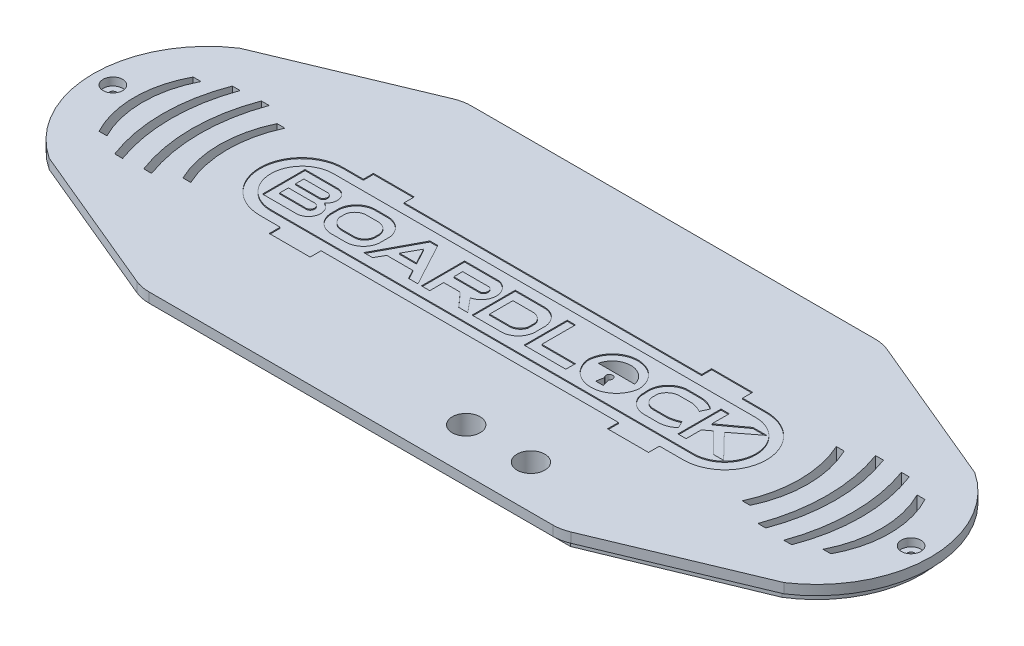
from build123d import *

# Parameters (mm, degrees)
BOSS_EXTRUDE3_DEPTH = 2.5
SKETCH2_8_R         = 3.55
BOSS_EXTRUDE4_DEPTH = 2.5
LOGO_DEPTH          = 0.25
FILLET1_R           = 10
SOUNDGAPS_REACH     = 178.856
BUTTONS_REACH       = 178.856
SKETCH5_R           = 3.55
CUT_EXTRUDE5_REACH  = 178.856
SKETCH9_R           = 2.5
CUT_EXTRUDE6_DEPTH  = 2
CUT_EXTRUDE7_REACH  = 178.856
SKETCH9_4_R         = 0.9


with BuildPart() as part:
    # Sketch2 → Boss-Extrude3 (new body)
    with BuildSketch(Plane(origin=(0, 0, 0), x_dir=(1, 0, 0), z_dir=(0, 1, 0))):
        with BuildLine():
            Line((-2.5, 2.5), (104.5, 2.5))
            Line((104.5, 2.5), (144.737244829, -14.291091061))
            ThreePointArc((144.737244829, -14.291091061), (157.8, -38.6), (144.737244829, -62.908908939))
            Line((144.737244829, -62.908908939), (104.5, -79.7))
            Line((104.5, -79.7), (-2.5, -79.7))
            Line((-2.5, -79.7), (-42.737244829, -62.908908939))
            ThreePointArc((-42.737244829, -62.908908939), (-55.8, -38.6), (-42.737244829, -14.291091061))
            Line((-42.737244829, -14.291091061), (-2.5, 2.5))
        make_face()
    extrude(amount=BOSS_EXTRUDE3_DEPTH)

    # Sketch2<8> → Boss-Extrude4 (add)
    with BuildSketch(Plane(origin=(0, 0, 0), x_dir=(1, 0, 0), z_dir=(0, 1, 0))):
        with BuildLine():
            Line((102, 0), (0, 0))
            Line((0, 0), (-2.5, 0))
            Line((-2.5, 0), (-40.702591635, -15.743739118))
            ThreePointArc((-40.702591635, -15.743739118), (-53.480653983, -38.6), (-40.702591635, -61.456260882))
            Line((-40.702591635, -61.456260882), (-2.5, -77.2))
            Line((-2.5, -77.2), (0, -77.2))
            Line((0, -77.2), (102, -77.2))
            Line((102, -77.2), (104.5, -77.2))
            Line((104.5, -77.2), (142.702591635, -61.456260882))
            ThreePointArc((142.702591635, -61.456260882), (155.480653983, -38.6), (142.702591635, -15.743739118))
            Line((142.702591635, -15.743739118), (104.5, 0))
            Line((104.5, 0), (102, 0))
        make_face()
        with Locations((69.32, -68.6)):
            Circle(SKETCH2_8_R, mode=Mode.SUBTRACT)
        with Locations((85.83, -68.6)):
            Circle(SKETCH2_8_R, mode=Mode.SUBTRACT)
    extrude(amount=-BOSS_EXTRUDE4_DEPTH)

    # Sketch3 → Logo (cut)
    # profile 1 of 10: a face of its own
    with BuildSketch(Plane(origin=(0, 2.5, 0), x_dir=(1, 0, 0), z_dir=(0, 1, 0))):
        with BuildLine():
            Line((1.949493887, -27.461955416), (-2.987330566, -27.461955416))
            ThreePointArc((-2.987330566, -27.461955416), (-13.803120325, -38.068295938), (-2.987330566, -48.674636459))
            Line((-2.987330566, -48.674636459), (1.949493887, -48.674636459))
            Line((1.949493887, -48.674636459), (1.949493887, -51.464582861))
            Line((1.949493887, -51.464582861), (12.371678844, -51.464582861))
            Line((12.371678844, -51.464582861), (12.371678844, -48.674636459))
            Line((12.371678844, -48.674636459), (88.239814758, -48.674636459))
            Line((88.239814758, -48.674636459), (88.239814758, -51.464582861))
            Line((88.239814758, -51.464582861), (98.688646078, -51.464582861))
            Line((98.688646078, -51.464582861), (98.688646078, -48.674636459))
            Line((98.688646078, -48.674636459), (104.624475689, -48.674636459))
            ThreePointArc((104.624475689, -48.674636459), (115.383426883, -38.068295938), (104.624475689, -27.461955416))
            Line((104.624475689, -27.461955416), (98.688646078, -27.461955416))
            Line((98.688646078, -27.461955416), (98.688646078, -24.902120515))
            Line((98.688646078, -24.902120515), (88.239814758, -24.902120515))
            Line((88.239814758, -24.902120515), (88.239814758, -27.461955416))
            Line((88.239814758, -27.461955416), (12.371678844, -27.461955416))
            Line((12.371678844, -27.461955416), (12.371678844, -24.902120515))
            Line((12.371678844, -24.902120515), (1.949493887, -24.902120515))
            Line((1.949493887, -24.902120515), (1.949493887, -27.461955416))
        make_face()
        with BuildLine():
            ThreePointArc((-3.194751797, -46.01575407), (-11.064312283, -37.938772353), (-2.987330566, -30.069211866))
            Line((-2.987330566, -30.069211866), (104.700239847, -30.069211866))
            ThreePointArc((104.700239847, -30.069211866), (112.673510949, -38.042482968), (104.700239847, -46.01575407))
            Line((104.700239847, -46.01575407), (-3.194751797, -46.01575407))
        make_face(mode=Mode.SUBTRACT)
    # profile 2 of 10: a face of its own
    with BuildSketch(Plane(origin=(0, 2.5, 0), x_dir=(1, 0, 0), z_dir=(0, 1, 0))):
        with BuildLine():
            Line((0.713326147, -32.762452382), (-7.630609586, -32.762452382))
            Line((-7.630609586, -32.762452382), (-7.630609586, -43.623173078))
            Line((-7.630609586, -43.623173078), (1.144127176, -43.623173078))
            ThreePointArc((1.144127176, -43.623173078), (4.072531045, -41.089719603), (2.23246662, -37.682653616))
            ThreePointArc((2.23246662, -37.682653616), (3.210405226, -34.686087135), (0.713326147, -32.762452382))
        make_face()
        with BuildLine():
            Line((-5.680668083, -41.17440933), (-5.680668083, -38.952382967))
            Line((-5.680668083, -38.952382967), (0.713326147, -38.952382967))
            ThreePointArc((0.713326147, -38.952382967), (2.127219592, -40.063396149), (0.713326147, -41.17440933))
            Line((0.713326147, -41.17440933), (-5.680668083, -41.17440933))
        make_face(mode=Mode.SUBTRACT)
        with BuildLine():
            Line((-5.680668083, -37.138483894), (-5.680668083, -35.007152484))
            Line((-5.680668083, -35.007152484), (0.600049584, -35.007152484))
            ThreePointArc((0.600049584, -35.007152484), (1.408506175, -36.072818189), (0.600049584, -37.138483894))
            Line((0.600049584, -37.138483894), (-5.680668083, -37.138483894))
        make_face(mode=Mode.SUBTRACT)
    # profile 3 of 10: a face of its own
    with BuildSketch(Plane(origin=(0, 2.5, 0), x_dir=(1, 0, 0), z_dir=(0, 1, 0))):
        with BuildLine():
            Line((5.346460441, -36.917426319), (5.346460441, -39.213930644))
            ThreePointArc((5.346460441, -39.213930644), (6.885943052, -42.434479638), (10.251793679, -43.623173078))
            Line((10.251793679, -43.623173078), (13.828264636, -43.623173078))
            ThreePointArc((13.828264636, -43.623173078), (16.716995574, -42.386317426), (18.096652452, -39.562999301))
            Line((18.096652452, -39.562999301), (18.096652452, -36.788822077))
            ThreePointArc((18.096652452, -36.788822077), (16.446939465, -33.787674903), (13.228063284, -32.618370223))
            Line((13.228063284, -32.618370223), (9.865980952, -32.618370223))
            ThreePointArc((9.865980952, -32.618370223), (6.816585637, -33.937769105), (5.346460441, -36.917426319))
        make_face()
        with BuildLine():
            ThreePointArc((7.340408181, -37.428569745), (8.31320862, -35.726361526), (10.137103318, -35.007152484))
            Line((10.137103318, -35.007152484), (13.346680486, -35.007152484))
            ThreePointArc((13.346680486, -35.007152484), (15.178018472, -35.715584435), (16.137891368, -37.428569745))
            Line((16.137891368, -37.428569745), (16.137891368, -38.787399969))
            ThreePointArc((16.137891368, -38.787399969), (15.339335986, -40.518029243), (13.608745934, -41.316669621))
            Line((13.608745934, -41.316669621), (10.291673968, -41.316669621))
            ThreePointArc((10.291673968, -41.316669621), (8.405132361, -40.657148151), (7.340408181, -38.965885242))
            Line((7.340408181, -38.965885242), (7.340408181, -37.428569745))
        make_face(mode=Mode.SUBTRACT)
    # profile 4 of 10: a face of its own
    with BuildSketch(Plane(origin=(0, 2.5, 0), x_dir=(1, 0, 0), z_dir=(0, 1, 0))):
        Polygon((24.087565187, -32.618370223), (18.222944768, -43.623173078), (20.462903956, -43.623173078), (21.766152938, -41.316669621), (28.404577439, -41.316669621), (29.646736625, -43.623173078), (32.02923867, -43.623173078), (26.102641459, -32.618370223), align=None)
        Polygon((27.243871315, -39.213930644), (22.906495797, -39.213930644), (25.095103323, -35.2239905), align=None, mode=Mode.SUBTRACT)
    # profile 5 of 10: a face of its own
    with BuildSketch(Plane(origin=(0, 2.5, 0), x_dir=(1, 0, 0), z_dir=(0, 1, 0))):
        with BuildLine():
            Line((41.793638287, -32.618370223), (32.928013354, -32.618370223))
            Line((32.928013354, -32.618370223), (32.928013354, -43.623173078))
            Line((32.928013354, -43.623173078), (35.04301538, -43.623173078))
            Line((35.04301538, -43.623173078), (35.04301538, -40.063396149))
            Line((35.04301538, -40.063396149), (39.244046803, -40.063396149))
            Line((39.244046803, -40.063396149), (42.431036158, -43.623173078))
            Line((42.431036158, -43.623173078), (44.737782461, -43.623173078))
            Line((44.737782461, -43.623173078), (41.793638287, -40.063396149))
            ThreePointArc((41.793638287, -40.063396149), (44.733866299, -36.340883186), (41.793638287, -32.618370223))
        make_face()
        with BuildLine():
            Line((35.04301538, -37.48051524), (35.04301538, -35.2239905))
            Line((35.04301538, -35.2239905), (41.793638287, -35.2239905))
            ThreePointArc((41.793638287, -35.2239905), (42.65693054, -36.35225287), (41.793638287, -37.48051524))
            Line((41.793638287, -37.48051524), (35.04301538, -37.48051524))
        make_face(mode=Mode.SUBTRACT)
    # profile 6 of 10: a face of its own
    with BuildSketch(Plane(origin=(0, 2.5, 0), x_dir=(1, 0, 0), z_dir=(0, 1, 0))):
        with BuildLine():
            Line((52.968722487, -32.618370223), (45.846335848, -32.618370223))
            Line((45.846335848, -32.618370223), (45.846335848, -43.623173078))
            Line((45.846335848, -43.623173078), (52.83287315, -43.623173078))
            ThreePointArc((52.83287315, -43.623173078), (56.080236632, -42.589880341), (57.64582107, -39.562999301))
            Line((57.64582107, -39.562999301), (57.64582107, -36.788822077))
            ThreePointArc((57.64582107, -36.788822077), (56.171000638, -33.734937317), (52.968722487, -32.618370223))
        make_face()
        with BuildLine():
            Line((47.864668846, -41.17440933), (47.864668846, -35.2239905))
            Line((47.864668846, -35.2239905), (52.599988574, -35.2239905))
            ThreePointArc((52.599988574, -35.2239905), (54.440160348, -35.663250015), (55.624586826, -37.138483894))
            Line((55.624586826, -37.138483894), (55.624586826, -39.18661223))
            ThreePointArc((55.624586826, -39.18661223), (54.462155657, -40.712863912), (52.599988574, -41.17440933))
            Line((52.599988574, -41.17440933), (47.864668846, -41.17440933))
        make_face(mode=Mode.SUBTRACT)
    # profile 7 of 10: a face of its own
    with BuildSketch(Plane(origin=(0, 2.5, 0), x_dir=(1, 0, 0), z_dir=(0, 1, 0))):
        Polygon((61.195413218, -32.618370223), (59.109629375, -32.618370223), (59.109629375, -43.623173078), (69.752475136, -43.623173078), (69.752475136, -41.187576484), (61.195413218, -41.187576484), align=None)
    # profile 8 of 10: a face of its own
    with BuildSketch(Plane(origin=(0, 2.5, 0), x_dir=(1, 0, 0), z_dir=(0, 1, 0))):
        with BuildLine():
            ThreePointArc((86.967057925, -37.33302991), (88.24698918, -35.587564651), (90.332173753, -35.007152484))
            Line((90.332173753, -35.007152484), (93.354874286, -35.007152484))
            ThreePointArc((93.354874286, -35.007152484), (94.768458464, -35.327728442), (96.082389221, -35.939753883))
            Line((96.082389221, -35.939753883), (96.979753441, -33.956106658))
            ThreePointArc((96.979753441, -33.956106658), (95.096667996, -32.952004021), (92.988844144, -32.618370223))
            Line((92.988844144, -32.618370223), (89.529268924, -32.618370223))
            ThreePointArc((89.529268924, -32.618370223), (85.927201794, -34.605805074), (84.941711164, -38.6))
            Line((84.941711164, -38.6), (84.941711164, -39.513929713))
            ThreePointArc((84.941711164, -39.513929713), (86.739352365, -42.572399213), (90.127806859, -43.623173078))
            Line((90.127806859, -43.623173078), (93.049792527, -43.623173078))
            ThreePointArc((93.049792527, -43.623173078), (95.178031827, -43.279186153), (97.039888867, -42.192347671))
            Line((97.039888867, -42.192347671), (96.15967403, -40.380436784))
            ThreePointArc((96.15967403, -40.380436784), (94.749505142, -40.914672607), (93.266431414, -41.187576484))
            Line((93.266431414, -41.187576484), (89.766541153, -41.187576484))
            ThreePointArc((89.766541153, -41.187576484), (87.98359415, -40.626914615), (86.967057925, -39.058509102))
            Line((86.967057925, -39.058509102), (86.967057925, -37.33302991))
        make_face()
    # profile 9 of 10: a face of its own
    with BuildSketch(Plane(origin=(0, 2.5, 0), x_dir=(1, 0, 0), z_dir=(0, 1, 0))):
        Polygon((100.433477861, -32.619456407), (98.346127272, -32.619456407), (98.346127272, -43.625930338), (100.433477861, -43.625930338), (100.433477861, -39.738654566), (102.223113581, -38.43184366), (107.375394287, -43.625930338), (110.007271118, -43.625930338), (103.904039503, -37.33302991), (110.007271118, -32.619456407), (106.490539146, -32.619456407), (100.433477861, -37.042386537), align=None)
    # profile 10 of 10: a face of its own
    with BuildSketch(Plane(origin=(0, 2.5, 0), x_dir=(1, 0, 0), z_dir=(0, 1, 0))):
        with BuildLine():
            ThreePointArc((83.440446503, -38.6), (76.914090873, -32.366505687), (70.387735243, -38.6))
            ThreePointArc((70.387735243, -38.6), (76.914090873, -44.419626268), (83.440446503, -38.6))
        make_face()
        with BuildLine():
            Line((75.957169691, -42.192347671), (76.285044547, -40.252788166))
            ThreePointArc((76.285044547, -40.252788166), (76.809249819, -38.728957059), (77.33345509, -40.252788166))
            Line((77.33345509, -40.252788166), (77.846095102, -42.192347671))
            Line((77.846095102, -42.192347671), (75.957169691, -42.192347671))
        make_face(mode=Mode.SUBTRACT)
        with BuildLine():
            Line((81.605728053, -37.905608877), (72.327294748, -37.905608877))
            ThreePointArc((72.327294748, -37.905608877), (76.9665114, -34.227223026), (81.605728053, -37.905608877))
        make_face(mode=Mode.SUBTRACT)
    extrude(amount=-LOGO_DEPTH, mode=Mode.SUBTRACT)

    # Fillet1
    fillet1_edges = [part.edges().sort_by_distance(p)[0] for p in [
        (-2.5, 1.25, -2.5),
        (104.5, 1.25, -2.5),
        (104.5, 1.25, 79.7),
        (-2.5, 1.25, 79.7),
    ]]
    fillet(fillet1_edges, radius=FILLET1_R)

    # Sketch4 → SoundGaps (cut, up to next)
    with BuildSketch(Plane(origin=(0, 2.5, 0), x_dir=(1, 0, 0), z_dir=(0, 1, 0)), mode=Mode.PRIVATE) as soundgaps_sk1:
        with BuildLine():
            Line((-42.336442958, -26.6), (-40.336442958, -26.6))
            ThreePointArc((-40.336442958, -26.6), (-43.210098634, -38.6), (-40.336442958, -50.6))
            Line((-40.336442958, -50.6), (-42.336442958, -50.6))
            ThreePointArc((-42.336442958, -50.6), (-45.345121926, -38.6), (-42.336442958, -26.6))
        make_face()
    soundgaps_tool1 = extrude(soundgaps_sk1.sketch, amount=-SOUNDGAPS_REACH, mode=Mode.PRIVATE) & part.part
    # Sketch4 → SoundGaps (cut, up to next)
    with BuildSketch(Plane(origin=(0, 2.5, 0), x_dir=(1, 0, 0), z_dir=(0, 1, 0)), mode=Mode.PRIVATE) as soundgaps_sk2:
        with BuildLine():
            Line((-35.336442958, -53.6), (-33.336442958, -53.6))
            ThreePointArc((-33.336442958, -53.6), (-35.959167646, -38.6), (-33.336442958, -23.6))
            Line((-33.336442958, -23.6), (-35.336442958, -23.6))
            ThreePointArc((-35.336442958, -23.6), (-38.112185635, -38.6), (-35.336442958, -53.6))
        make_face()
    soundgaps_tool2 = extrude(soundgaps_sk2.sketch, amount=-SOUNDGAPS_REACH, mode=Mode.PRIVATE) & part.part
    # Sketch4 → SoundGaps (cut, up to next)
    with BuildSketch(Plane(origin=(0, 2.5, 0), x_dir=(1, 0, 0), z_dir=(0, 1, 0)), mode=Mode.PRIVATE) as soundgaps_sk3:
        with BuildLine():
            Line((-28.336442958, -23.2), (-26.336442958, -23.2))
            ThreePointArc((-26.336442958, -23.2), (-28.980435332, -38.2), (-26.336442958, -53.2))
            Line((-26.336442958, -53.2), (-28.336442958, -53.2))
            ThreePointArc((-28.336442958, -53.2), (-31.075866522, -38.2), (-28.336442958, -23.2))
        make_face()
    soundgaps_tool3 = extrude(soundgaps_sk3.sketch, amount=-SOUNDGAPS_REACH, mode=Mode.PRIVATE) & part.part
    # Sketch4 → SoundGaps (cut, up to next)
    with BuildSketch(Plane(origin=(0, 2.5, 0), x_dir=(1, 0, 0), z_dir=(0, 1, 0)), mode=Mode.PRIVATE) as soundgaps_sk4:
        with BuildLine():
            Line((-21.336442958, -50.2), (-19.336442958, -50.2))
            ThreePointArc((-19.336442958, -50.2), (-21.944289857, -38.2), (-19.336442958, -26.2))
            Line((-19.336442958, -26.2), (-21.336442958, -26.2))
            ThreePointArc((-21.336442958, -26.2), (-24.039371453, -38.2), (-21.336442958, -50.2))
        make_face()
    soundgaps_tool4 = extrude(soundgaps_sk4.sketch, amount=-SOUNDGAPS_REACH, mode=Mode.PRIVATE) & part.part
    # Sketch4 → SoundGaps (cut, up to next)
    with BuildSketch(Plane(origin=(0, 2.5, 0), x_dir=(1, 0, 0), z_dir=(0, 1, 0)), mode=Mode.PRIVATE) as soundgaps_sk5:
        with BuildLine():
            Line((123.336442958, -26.2), (121.336442958, -26.2))
            ThreePointArc((121.336442958, -26.2), (123.944289857, -38.2), (121.336442958, -50.2))
            Line((121.336442958, -50.2), (123.336442958, -50.2))
            ThreePointArc((123.336442958, -50.2), (126.039371453, -38.2), (123.336442958, -26.2))
        make_face()
    soundgaps_tool5 = extrude(soundgaps_sk5.sketch, amount=-SOUNDGAPS_REACH, mode=Mode.PRIVATE) & part.part
    # Sketch4 → SoundGaps (cut, up to next)
    with BuildSketch(Plane(origin=(0, 2.5, 0), x_dir=(1, 0, 0), z_dir=(0, 1, 0)), mode=Mode.PRIVATE) as soundgaps_sk6:
        with BuildLine():
            Line((130.336442958, -53.2), (128.336442958, -53.2))
            ThreePointArc((128.336442958, -53.2), (130.980435332, -38.2), (128.336442958, -23.2))
            Line((128.336442958, -23.2), (130.336442958, -23.2))
            ThreePointArc((130.336442958, -23.2), (133.075866522, -38.2), (130.336442958, -53.2))
        make_face()
    soundgaps_tool6 = extrude(soundgaps_sk6.sketch, amount=-SOUNDGAPS_REACH, mode=Mode.PRIVATE) & part.part
    # Sketch4 → SoundGaps (cut, up to next)
    with BuildSketch(Plane(origin=(0, 2.5, 0), x_dir=(1, 0, 0), z_dir=(0, 1, 0)), mode=Mode.PRIVATE) as soundgaps_sk7:
        with BuildLine():
            Line((137.336442958, -23.6), (135.336442958, -23.6))
            ThreePointArc((135.336442958, -23.6), (137.959167646, -38.6), (135.336442958, -53.6))
            Line((135.336442958, -53.6), (137.336442958, -53.6))
            ThreePointArc((137.336442958, -53.6), (140.112185635, -38.6), (137.336442958, -23.6))
        make_face()
    soundgaps_tool7 = extrude(soundgaps_sk7.sketch, amount=-SOUNDGAPS_REACH, mode=Mode.PRIVATE) & part.part
    # Sketch4 → SoundGaps (cut, up to next)
    with BuildSketch(Plane(origin=(0, 2.5, 0), x_dir=(1, 0, 0), z_dir=(0, 1, 0)), mode=Mode.PRIVATE) as soundgaps_sk8:
        with BuildLine():
            Line((144.336442958, -50.6), (142.336442958, -50.6))
            ThreePointArc((142.336442958, -50.6), (145.210098634, -38.6), (142.336442958, -26.6))
            Line((142.336442958, -26.6), (144.336442958, -26.6))
            ThreePointArc((144.336442958, -26.6), (147.345121926, -38.6), (144.336442958, -50.6))
        make_face()
    soundgaps_tool8 = extrude(soundgaps_sk8.sketch, amount=-SOUNDGAPS_REACH, mode=Mode.PRIVATE) & part.part
    add(soundgaps_tool1.solids().sort_by_distance((-43.336866, 2.5, 38.6))[0], mode=Mode.SUBTRACT)
    add(soundgaps_tool2.solids().sort_by_distance((-36.164676, 2.5, 38.6))[0], mode=Mode.SUBTRACT)
    add(soundgaps_tool3.solids().sort_by_distance((-29.153278, 2.5, 38.2))[0], mode=Mode.SUBTRACT)
    add(soundgaps_tool4.solids().sort_by_distance((-22.134482, 2.5, 38.2))[0], mode=Mode.SUBTRACT)
    add(soundgaps_tool5.solids().sort_by_distance((124.134482, 2.5, 38.2))[0], mode=Mode.SUBTRACT)
    add(soundgaps_tool6.solids().sort_by_distance((131.153278, 2.5, 38.2))[0], mode=Mode.SUBTRACT)
    add(soundgaps_tool7.solids().sort_by_distance((138.164676, 2.5, 38.6))[0], mode=Mode.SUBTRACT)
    add(soundgaps_tool8.solids().sort_by_distance((145.336866, 2.5, 38.6))[0], mode=Mode.SUBTRACT)

    # Sketch5 → Buttons (cut, up to next)
    with BuildSketch(Plane(origin=(0, 2.5, 0), x_dir=(1, 0, 0), z_dir=(0, 1, 0)), mode=Mode.PRIVATE) as buttons_sk1:
        with Locations((69.32, -68.6)):
            Circle(SKETCH5_R)
    buttons_tool1 = extrude(buttons_sk1.sketch, amount=-BUTTONS_REACH, mode=Mode.PRIVATE) & part.part
    # Sketch5 → Buttons (cut, up to next)
    with BuildSketch(Plane(origin=(0, 2.5, 0), x_dir=(1, 0, 0), z_dir=(0, 1, 0)), mode=Mode.PRIVATE) as buttons_sk2:
        with Locations((85.83, -68.6)):
            Circle(SKETCH5_R)
    buttons_tool2 = extrude(buttons_sk2.sketch, amount=-BUTTONS_REACH, mode=Mode.PRIVATE) & part.part
    add(buttons_tool1.solids().sort_by_distance((69.32, 2.5, 68.6))[0], mode=Mode.SUBTRACT)
    add(buttons_tool2.solids().sort_by_distance((85.83, 2.5, 68.6))[0], mode=Mode.SUBTRACT)

    # Sketch3<5> → Cut-Extrude5 (cut, up to next)
    with BuildSketch(Plane(origin=(0, 2.5, 0), x_dir=(1, 0, 0), z_dir=(0, 1, 0)), mode=Mode.PRIVATE) as cut_extrude5_sk1:
        with BuildLine():
            ThreePointArc((81.605728053, -37.905608877), (76.9665114, -34.227223026), (72.327294748, -37.905608877))
            Line((72.327294748, -37.905608877), (81.605728053, -37.905608877))
        make_face()
    cut_extrude5_tool1 = extrude(cut_extrude5_sk1.sketch, amount=-CUT_EXTRUDE5_REACH, mode=Mode.PRIVATE) & part.part
    # Sketch3<5> → Cut-Extrude5 (cut, up to next)
    with BuildSketch(Plane(origin=(0, 2.5, 0), x_dir=(1, 0, 0), z_dir=(0, 1, 0)), mode=Mode.PRIVATE) as cut_extrude5_sk2:
        with BuildLine():
            ThreePointArc((77.33345509, -40.252788166), (76.809249819, -38.728957059), (76.285044547, -40.252788166))
            Line((76.285044547, -40.252788166), (75.957169691, -42.192347671))
            Line((75.957169691, -42.192347671), (77.846095102, -42.192347671))
            Line((77.846095102, -42.192347671), (77.33345509, -40.252788166))
        make_face()
    cut_extrude5_tool2 = extrude(cut_extrude5_sk2.sketch, amount=-CUT_EXTRUDE5_REACH, mode=Mode.PRIVATE) & part.part
    add(cut_extrude5_tool1.solids().sort_by_distance((76.966511, 2.5, 36.371206))[0], mode=Mode.SUBTRACT)
    add(cut_extrude5_tool2.solids().sort_by_distance((76.838073, 2.5, 40.549632))[0], mode=Mode.SUBTRACT)

    # Sketch9 → Cut-Extrude6 (cut)
    with BuildSketch(Plane(origin=(0, 2.5, 0), x_dir=(1, 0, 0), z_dir=(0, 1, 0))):
        with Locations((-50.8, -38.6)):
            Circle(SKETCH9_R)
        with Locations((152.8, -38.6)):
            Circle(SKETCH9_R)
    extrude(amount=-CUT_EXTRUDE6_DEPTH, mode=Mode.SUBTRACT)

    # Sketch9<4> → Cut-Extrude7 (cut, up to next)
    with BuildSketch(Plane(origin=(0, 2.5, 0), x_dir=(1, 0, 0), z_dir=(0, 1, 0)), mode=Mode.PRIVATE) as cut_extrude7_sk1:
        with Locations((-50.8, -38.6)):
            Circle(SKETCH9_4_R)
    cut_extrude7_tool1 = extrude(cut_extrude7_sk1.sketch, amount=-CUT_EXTRUDE7_REACH, mode=Mode.PRIVATE) & part.part
    # Sketch9<4> → Cut-Extrude7 (cut, up to next)
    with BuildSketch(Plane(origin=(0, 2.5, 0), x_dir=(1, 0, 0), z_dir=(0, 1, 0)), mode=Mode.PRIVATE) as cut_extrude7_sk2:
        with Locations((152.8, -38.6)):
            Circle(SKETCH9_4_R)
    cut_extrude7_tool2 = extrude(cut_extrude7_sk2.sketch, amount=-CUT_EXTRUDE7_REACH, mode=Mode.PRIVATE) & part.part
    add(cut_extrude7_tool1.solids().sort_by_distance((-50.8, 2.5, 38.6))[0], mode=Mode.SUBTRACT)
    add(cut_extrude7_tool2.solids().sort_by_distance((152.8, 2.5, 38.6))[0], mode=Mode.SUBTRACT)


solid = part.part
